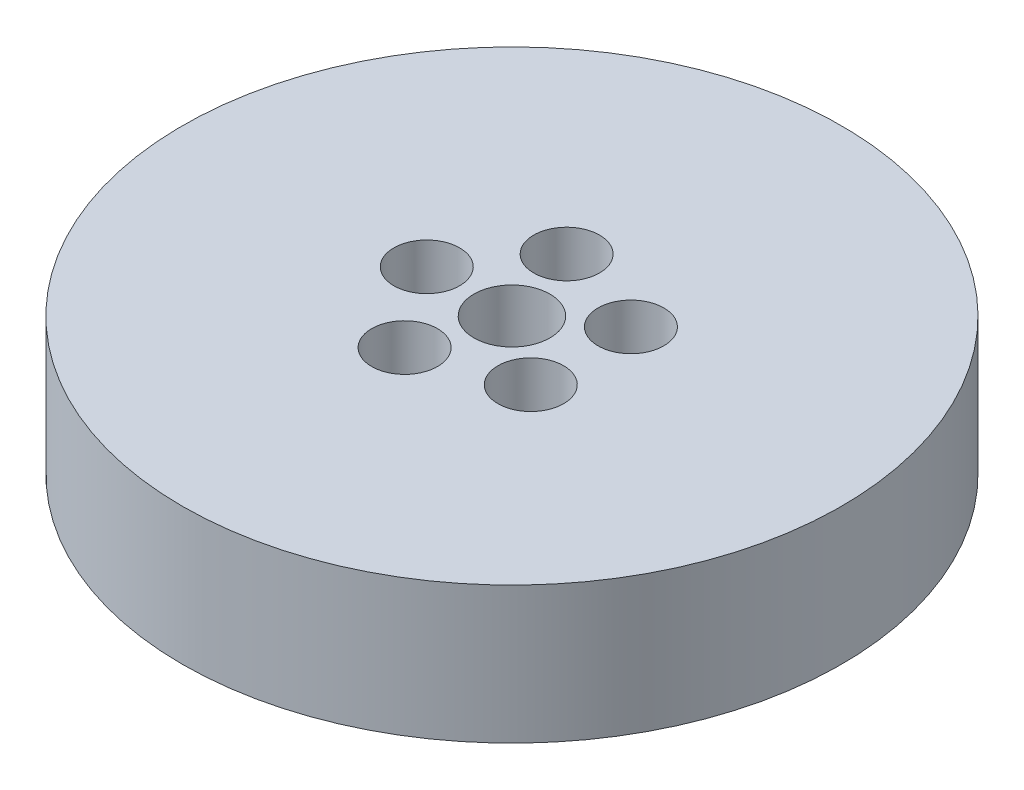
from build123d import *

# Parameters (mm, degrees)
SKETCH1_R           = 65
BOSS_EXTRUDE1_DEPTH = 27
SKETCH2_R           = 7.5
CUT_EXTRUDE1_DEPTH  = 96.807097858
SKETCH3_R           = 6.48724829
CUT_EXTRUDE2_DEPTH  = 21.005107189
CIRPATTERN1_COUNT   = 5


with BuildPart() as part:
    # Sketch1 → Boss-Extrude1 (new body)
    with BuildSketch(Plane(origin=(0, 0, 0), x_dir=(1, 0, 0), z_dir=(0, 1, 0))):
        Circle(SKETCH1_R)
    extrude(amount=BOSS_EXTRUDE1_DEPTH)

    # Sketch2 → Cut-Extrude1 (cut, through all)
    with BuildSketch(Plane(origin=(0, 0, 0), x_dir=(1, 0, 0), z_dir=(0, 1, 0))):
        Circle(SKETCH2_R)
    extrude(amount=CUT_EXTRUDE1_DEPTH, mode=Mode.SUBTRACT)

    # Sketch3 → Cut-Extrude2 (cut)
    with BuildSketch(Plane(origin=(0, 27, 0), x_dir=(1, 0, 0), z_dir=(0, 1, 0))):
        with Locations((-16.80132063, 0)):
            Circle(SKETCH3_R)
    cut_extrude2 = extrude(amount=-CUT_EXTRUDE2_DEPTH, mode=Mode.SUBTRACT)

    # CirPattern1: Cut-Extrude2 ×5 about axis
    cirpattern1_axis = Axis((0, 0, 0), (0, 1, 0))
    for i in range(1, CIRPATTERN1_COUNT):
        add(cut_extrude2.rotate(cirpattern1_axis, i * 360 / CIRPATTERN1_COUNT), mode=Mode.SUBTRACT)


solid = part.part
